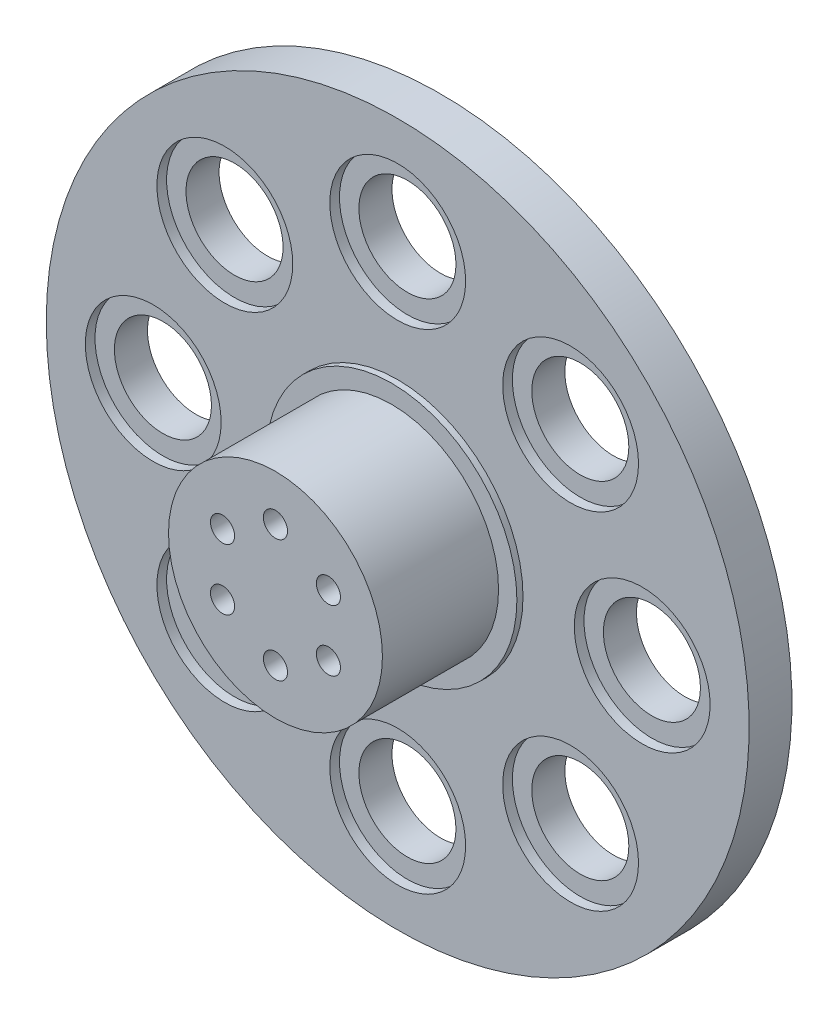
from build123d import *

# Parameters (mm, degrees)
SKETCH1_R           = 17.5
BOSS_EXTRUDE1_DEPTH = 19
SKETCH7_R           = 20.5
BOSS_EXTRUDE3_DEPTH = 1
SKETCH3_R           = 57.5
BOSS_EXTRUDE2_DEPTH = 7
SKETCH4_R           = 11
CUT_EXTRUDE1_DEPTH  = 7
SKETCH5_R           = 7.5
CUT_EXTRUDE2_DEPTH  = 0.5
SKETCH6_R           = 1.975
CUT_EXTRUDE3_DEPTH  = 10
CIRPATTERN1_COUNT   = 6
SKETCH8_R           = 7.94
CUT_EXTRUDE4_DEPTH  = 84.740671122
SKETCH9_R           = 11.1125
CUT_EXTRUDE5_DEPTH  = 1.5875
CHAMFER1_SIZE       = 1


with BuildPart() as part:
    # Sketch1 → Boss-Extrude1 (new body)
    with BuildSketch(Plane.XY):
        Circle(SKETCH1_R)
    extrude(amount=BOSS_EXTRUDE1_DEPTH)

    # Sketch7 → Boss-Extrude3 (add)
    with BuildSketch(Plane(origin=(0, 0, 0), x_dir=(-1, 0, 0), z_dir=(0, 0, -1))):
        Circle(SKETCH7_R)
    extrude(amount=BOSS_EXTRUDE3_DEPTH)

    # Sketch3 → Boss-Extrude2 (add)
    with BuildSketch(Plane(origin=(0, 0, -1), x_dir=(-1, 0, 0), z_dir=(0, 0, -1))):
        Circle(SKETCH3_R)
    extrude(amount=BOSS_EXTRUDE2_DEPTH)

    # Sketch4 → Cut-Extrude1 (cut)
    with BuildSketch(Plane(origin=(0, 0, -8), x_dir=(-1, 0, 0), z_dir=(0, 0, -1))):
        Circle(SKETCH4_R)
    extrude(amount=-CUT_EXTRUDE1_DEPTH, mode=Mode.SUBTRACT)

    # Sketch5 → Cut-Extrude2 (cut)
    with BuildSketch(Plane(origin=(0, 0, -1), x_dir=(-1, 0, 0), z_dir=(0, 0, -1))):
        Circle(SKETCH5_R)
    extrude(amount=-CUT_EXTRUDE2_DEPTH, mode=Mode.SUBTRACT)

    # Sketch6 → Cut-Extrude3 (cut)
    with BuildSketch(Plane.XY.offset(19)):
        with Locations((0, 10)):
            Circle(SKETCH6_R)
    cut_extrude3 = extrude(amount=-CUT_EXTRUDE3_DEPTH, mode=Mode.SUBTRACT)

    # CirPattern1: Cut-Extrude3 ×6 about axis
    cirpattern1_axis = Axis((0, 0, 19), (0, 0, 1))
    for i in range(1, CIRPATTERN1_COUNT):
        add(cut_extrude3.rotate(cirpattern1_axis, i * 360 / CIRPATTERN1_COUNT), mode=Mode.SUBTRACT)

    # Sketch8 → Cut-Extrude4 (cut, through all)
    with BuildSketch(Plane.XY.offset(-1)):
        with Locations((-40, 0)):
            Circle(SKETCH8_R)
        with Locations((-28.284271247, 28.284271247)):
            Circle(SKETCH8_R)
        with Locations((0, 40)):
            Circle(SKETCH8_R)
        with Locations((28.284271247, 28.284271247)):
            Circle(SKETCH8_R)
        with Locations((40, 0)):
            Circle(SKETCH8_R)
        with Locations((28.284271247, -28.284271247)):
            Circle(SKETCH8_R)
        with Locations((0, -40)):
            Circle(SKETCH8_R)
        with Locations((-28.284271247, -28.284271247)):
            Circle(SKETCH8_R)
    extrude(amount=-CUT_EXTRUDE4_DEPTH, mode=Mode.SUBTRACT)

    # Sketch9 → Cut-Extrude5 (cut)
    with BuildSketch(Plane.XY.offset(-1)):
        with Locations((0, 40)):
            Circle(SKETCH9_R)
        with Locations((28.284271247, 28.284271247)):
            Circle(SKETCH9_R)
        with Locations((40, 0)):
            Circle(SKETCH9_R)
        with Locations((28.284271247, -28.284271247)):
            Circle(SKETCH9_R)
        with Locations((0, -40)):
            Circle(SKETCH9_R)
        with Locations((-28.284271247, -28.284271247)):
            Circle(SKETCH9_R)
        with Locations((-40, 0)):
            Circle(SKETCH9_R)
        with Locations((-28.284271247, 28.284271247)):
            Circle(SKETCH9_R)
    extrude(amount=-CUT_EXTRUDE5_DEPTH, mode=Mode.SUBTRACT)

    # Chamfer1
    chamfer1_edges = [part.edges().sort_by_distance(p)[0] for p in [
        (11, 0, -8),
    ]]
    chamfer(chamfer1_edges, length=CHAMFER1_SIZE)


solid = part.part
